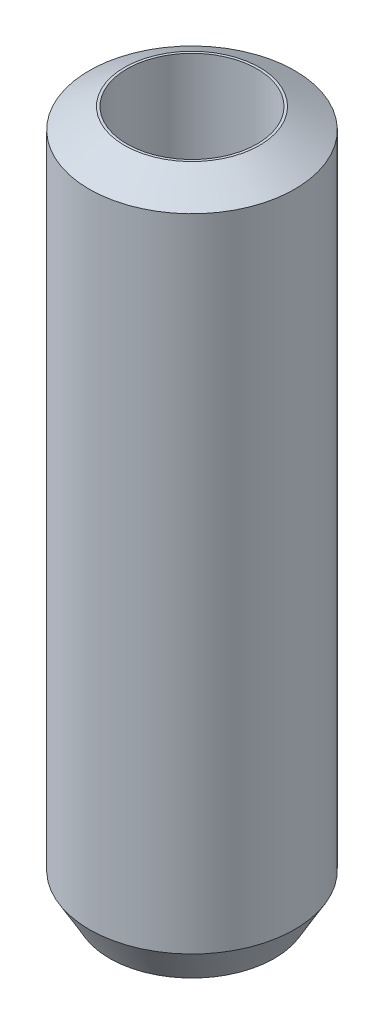
from build123d import *
from OCP.BRepFilletAPI import BRepFilletAPI_MakeChamfer

# Parameters (mm, degrees)
SKETCH1_R           = 17.5
BOSS_EXTRUDE1_DEPTH = 118.622075651
SKETCH2_R           = 11.083904727
CUT_EXTRUDE1_DEPTH  = 122.176304746
CHAMFER1_SIZE       = 3.460976616
CHAMFER1_SIZE2      = 5.994587343


with BuildPart() as part:
    # Sketch1 → Boss-Extrude1 (new body)
    with BuildSketch(Plane(origin=(0, 0, 0), x_dir=(1, 0, 0), z_dir=(0, 1, 0))):
        Circle(SKETCH1_R)
    extrude(amount=BOSS_EXTRUDE1_DEPTH)

    # Sketch2 → Cut-Extrude1 (cut, through all)
    with BuildSketch(Plane(origin=(0, 0, 0), x_dir=(1, 0, 0), z_dir=(0, 1, 0))):
        Circle(SKETCH2_R)
    extrude(amount=CUT_EXTRUDE1_DEPTH, mode=Mode.SUBTRACT)

    # Chamfer1: one chamfer whose edges measure the first distance from different faces: ONE call of the kernel's chamfer builder (chamfer() names one face for all edges)
    chamfer1_edges_1 = [part.edges().sort_by_distance(p)[0] for p in [
        (-17.5, 118.622075651, 0),
    ]]
    chamfer1_side_1 = [part.faces().sort_by_distance(p)[0] for p in [
        (-17.5, 59.311037826, 0),
    ]]
    chamfer1_edges_2 = [part.edges().sort_by_distance(p)[0] for p in [
        (-17.5, 0, 0),
    ]]
    chamfer1_side_2 = [part.faces().sort_by_distance(p)[0] for p in [
        (-17.005025253, 0, 0),
    ]]
    chamfer1 = BRepFilletAPI_MakeChamfer(part.part.solid().wrapped)
    for e in chamfer1_edges_1:
        chamfer1.Add(CHAMFER1_SIZE, CHAMFER1_SIZE2, e.wrapped, chamfer1_side_1[0].wrapped)  # the first distance lies on this face
    for e in chamfer1_edges_2:
        chamfer1.Add(CHAMFER1_SIZE, CHAMFER1_SIZE2, e.wrapped, chamfer1_side_2[0].wrapped)  # the first distance lies on this face
    add(Compound.cast(chamfer1.Shape()), mode=Mode.REPLACE)


solid = part.part
